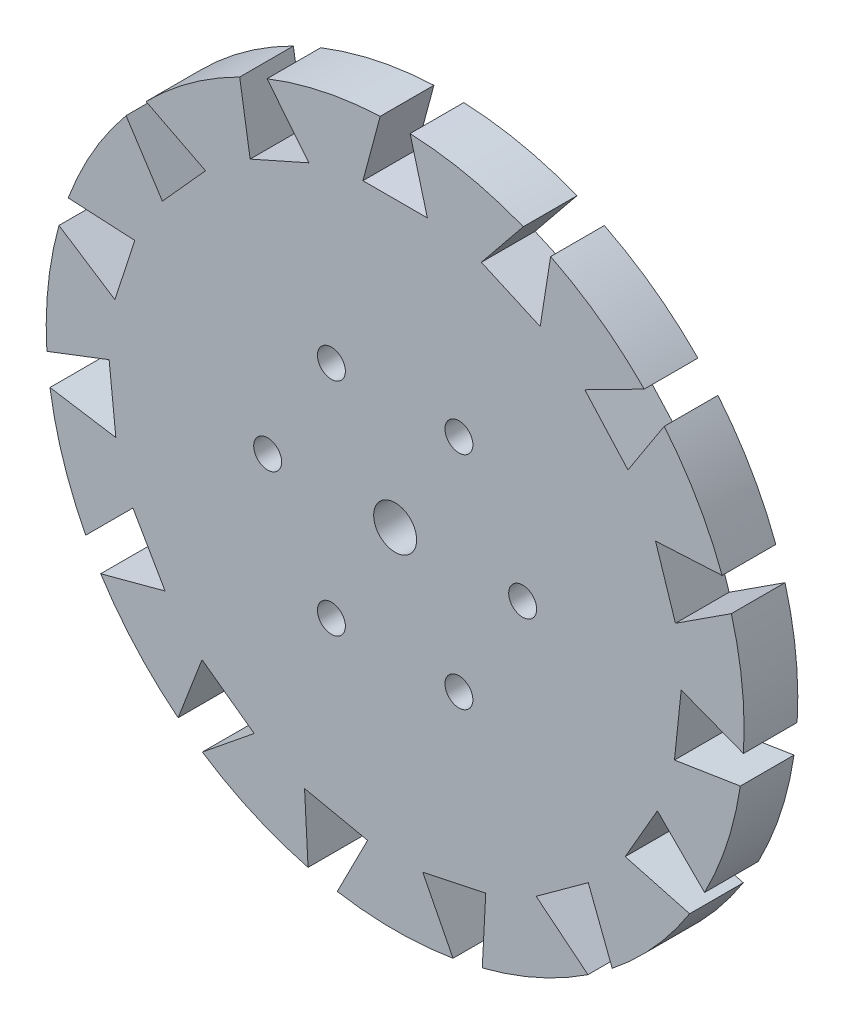
from build123d import *

# Parameters (mm, degrees)
SKETCH1_R               = 65
BOSS_EXTRUDE1_DEPTH     = 10
CUT_EXTRUDE1_DEPTH      = 93.466210045
CIRPATTERN2_DEPTH       = 10
CUT_EXTRUDE2_DEPTH      = 93.466210045
CUT_EXTRUDE2_DEPTH_BACK = 93.466210045
SKETCH3_R               = 4
CUT_EXTRUDE3_DEPTH      = 93.466210045
CUT_EXTRUDE3_DEPTH_BACK = 93.466210045
SKETCH4_R               = 2.6


# Read off the part's stored shape, not the designer's step: CirPattern2
with BuildPart() as part:
    # Sketch1 → Boss-Extrude1 (new body)
    with BuildSketch(Plane.XY):
        Circle(SKETCH1_R)
    extrude(amount=BOSS_EXTRUDE1_DEPTH)

    # Sketch2 → Cut-Extrude1 (cut, symmetric)
    with BuildSketch(Plane.XY.offset(10)):
        Polygon((-2.784609691, 64.940326061), (-6, 52.940326061), (6, 52.940326061), (2.784609691, 64.940326061), align=None)
    extrude(amount=CUT_EXTRUDE1_DEPTH, both=True, mode=Mode.SUBTRACT)


with BuildPart() as cut_extrude1_kept_piece:
    # of the separate pieces the step leaves, the one the design keeps (cut_extrude1_pieces_kept)
    add(part.part.solids().sort_by_distance((65, 0, 0))[0])

    # CirPattern2 outline → CirPattern2 (cut)
    with BuildSketch(Plane.XY):
        with BuildLine():
            Line((-27.014043251, 45.92297454), (-16.051497759, 50.803814257))
            Line((-16.051497759, 50.803814257), (-23.869742688, 60.458542689))
            ThreePointArc((-23.869742688, 60.458542689), (-26.4378818, 59.380454747), (-28.957477757, 58.193337093))
            Line((-28.957477757, 58.193337093), (-27.014043251, 45.92297454))
        make_face()
        with BuildLine():
            Line((27.014043251, 45.92297454), (28.957477757, 58.193337093))
            ThreePointArc((28.957477757, 58.193337093), (26.4378818, 59.380454747), (23.869742688, 60.458542689))
            Line((23.869742688, 60.458542689), (16.051497759, 50.803814257))
            Line((16.051497759, 50.803814257), (27.014043251, 45.92297454))
        make_face()
        with BuildLine():
            Line((43.357113009, 30.965123525), (50.123334848, 41.384191471))
            ThreePointArc((50.123334848, 41.384191471), (48.304413656, 43.493489413), (46.396799706, 45.522928037))
            Line((46.396799706, 45.522928037), (35.327545733, 39.882861431))
            Line((35.327545733, 39.882861431), (43.357113009, 30.965123525))
        make_face()
        with BuildLine():
            Line((52.203344041, 10.653121343), (62.622411988, 17.419343181))
            ThreePointArc((62.622411988, 17.419343181), (61.818673559, 20.086104634), (60.901428553, 22.715985565))
            Line((60.901428553, 22.715985565), (48.495140109, 22.065799538))
            Line((48.495140109, 22.065799538), (52.203344041, 10.653121343))
        make_face()
        with BuildLine():
            Line((52.023142636, -11.5009023), (64.293505188, -9.557467795))
            ThreePointArc((64.293505188, -9.557467795), (64.643923199, -6.794350113), (64.875647132, -4.01875718))
            Line((64.875647132, -4.01875718), (53.277484195, 0.433360444))
            Line((53.277484195, 0.433360444), (52.023142636, -11.5009023))
        make_face()
        with BuildLine():
            Line((42.847667253, -31.666315453), (54.847667253, -34.881705762))
            ThreePointArc((54.847667253, -34.881705762), (56.291651246, -32.5), (57.632276944, -30.058620298))
            Line((57.632276944, -30.058620298), (48.847667253, -21.274010608))
            Line((48.847667253, -21.274010608), (42.847667253, -31.666315453))
        make_face()
        with BuildLine():
            Line((26.263440944, -46.356334985), (35.918169375, -54.174579913))
            ThreePointArc((35.918169375, -54.174579913), (38.206041399, -52.586104634), (40.4237625, -50.901074894))
            Line((40.4237625, -50.901074894), (35.971644876, -39.302911957))
            Line((35.971644876, -39.302911957), (26.263440944, -46.356334985))
        make_face()
        with BuildLine():
            Line((5.138027099, -53.030923063), (10.778093705, -64.100177036))
            ThreePointArc((10.778093705, -64.100177036), (13.514259903, -63.579594048), (16.225612282, -62.942271218))
            Line((16.225612282, -62.942271218), (16.875798308, -50.535982773))
            Line((16.875798308, -50.535982773), (5.138027099, -53.030923063))
        make_face()
        with BuildLine():
            Line((-16.875798308, -50.535982773), (-16.225612282, -62.942271218))
            ThreePointArc((-16.225612282, -62.942271218), (-13.514259903, -63.579594048), (-10.778093705, -64.100177036))
            Line((-10.778093705, -64.100177036), (-5.138027099, -53.030923063))
            Line((-5.138027099, -53.030923063), (-16.875798308, -50.535982773))
        make_face()
        with BuildLine():
            Line((-35.971644876, -39.302911957), (-40.4237625, -50.901074894))
            ThreePointArc((-40.4237625, -50.901074894), (-38.206041399, -52.586104634), (-35.918169375, -54.174579913))
            Line((-35.918169375, -54.174579913), (-26.263440944, -46.356334985))
            Line((-26.263440944, -46.356334985), (-35.971644876, -39.302911957))
        make_face()
        with BuildLine():
            Line((-48.847667253, -21.274010608), (-57.632276944, -30.058620298))
            ThreePointArc((-57.632276944, -30.058620298), (-56.291651246, -32.5), (-54.847667253, -34.881705762))
            Line((-54.847667253, -34.881705762), (-42.847667253, -31.666315453))
            Line((-42.847667253, -31.666315453), (-48.847667253, -21.274010608))
        make_face()
        with BuildLine():
            Line((-53.277484195, 0.433360444), (-64.875647132, -4.01875718))
            ThreePointArc((-64.875647132, -4.01875718), (-64.643923199, -6.794350113), (-64.293505188, -9.557467795))
            Line((-64.293505188, -9.557467795), (-52.023142636, -11.5009023))
            Line((-52.023142636, -11.5009023), (-53.277484195, 0.433360444))
        make_face()
        with BuildLine():
            Line((-48.495140109, 22.065799538), (-60.901428553, 22.715985565))
            ThreePointArc((-60.901428553, 22.715985565), (-61.818673559, 20.086104634), (-62.622411988, 17.419343181))
            Line((-62.622411988, 17.419343181), (-52.203344041, 10.653121343))
            Line((-52.203344041, 10.653121343), (-48.495140109, 22.065799538))
        make_face()
        with BuildLine():
            Line((-35.327545733, 39.882861431), (-46.396799706, 45.522928037))
            ThreePointArc((-46.396799706, 45.522928037), (-48.304413656, 43.493489413), (-50.123334848, 41.384191471))
            Line((-50.123334848, 41.384191471), (-43.357113009, 30.965123525))
            Line((-43.357113009, 30.965123525), (-35.327545733, 39.882861431))
        make_face()
    extrude(amount=CIRPATTERN2_DEPTH, mode=Mode.SUBTRACT)

    # Sketch3 → Cut-Extrude2 (cut, two sides: drawn at the far end of the back side and taken through both)
    with BuildSketch(Plane.XY.offset(10).offset(-CUT_EXTRUDE2_DEPTH_BACK)):
        Circle(SKETCH3_R)
    extrude(amount=CUT_EXTRUDE2_DEPTH + CUT_EXTRUDE2_DEPTH_BACK, mode=Mode.SUBTRACT)

    # Sketch4 → Cut-Extrude3 (cut, two sides: drawn at the far end of the back side and taken through both)
    with BuildSketch(Plane.XY.offset(10).offset(-CUT_EXTRUDE3_DEPTH_BACK)):
        with Locations((-23.75, 0)):
            Circle(SKETCH4_R)
        with Locations((-11.875, 20.56810334)):
            Circle(SKETCH4_R)
        with Locations((11.875, 20.56810334)):
            Circle(SKETCH4_R)
        with Locations((23.75, 0)):
            Circle(SKETCH4_R)
        with Locations((11.875, -20.56810334)):
            Circle(SKETCH4_R)
        with Locations((-11.875, -20.56810334)):
            Circle(SKETCH4_R)
    extrude(amount=CUT_EXTRUDE3_DEPTH + CUT_EXTRUDE3_DEPTH_BACK, mode=Mode.SUBTRACT)


solid = cut_extrude1_kept_piece.part
